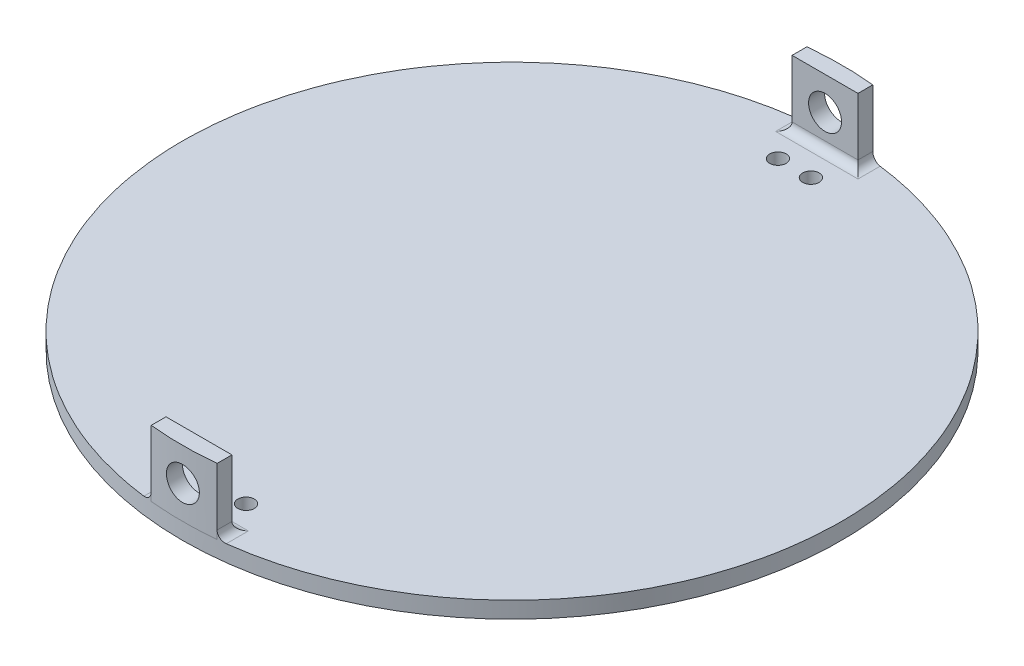
from build123d import *

# Parameters (mm, degrees)
SKETCH1_R               = 50.8
BOSS_EXTRUDE1_DEPTH     = 2.54
BOSS_EXTRUDE2_DEPTH     = 10.16
FILLET1_R               = 1.27
CUT_EXTRUDE1_DEPTH      = 113.048264746
CUT_EXTRUDE1_DEPTH_BACK = 113.048264746
SKETCH3_R               = 2.54
SKETCH5_R               = 1.27
CUT_EXTRUDE2_DEPTH      = 73.556912988


# Read off the part's stored shape, not the designer's step: Boss-Extrude2
with BuildPart() as part:
    # Sketch1 → Boss-Extrude1 (new body)
    with BuildSketch(Plane(origin=(0, 0, 0), x_dir=(1, 0, 0), z_dir=(0, 1, 0))):
        with Locations(Location((0, 0, 0), (0, 0, 270))):
            Circle(SKETCH1_R)
    extrude(amount=BOSS_EXTRUDE1_DEPTH)


with BuildPart() as boss_extrude2_tool:
    # Boss-Extrude2 outline → Boss-Extrude2 (new body)
    with BuildSketch(Plane(origin=(0, 2.54, 0), x_dir=(1, 0, 0), z_dir=(0, 1, 0))):
        with BuildLine():
            Line((-5.08, -48.26), (-5.08, -50.545361805))
            add(Edge.make_bspline(
                [(5.08, -50.545361805), (0, -51.054638195), (-5.08, -50.545361805)],
                knots=[0, 0, 0, 1, 1, 1], degree=2))
            Line((5.08, -50.545361805), (5.08, -48.26))
            Line((5.08, -48.26), (-5.08, -48.26))
        make_face()
        with BuildLine():
            Line((5.08, 48.26), (5.08, 50.545361805))
            add(Edge.make_bspline(
                [(-5.08, 50.545361805), (0, 51.054638195), (5.08, 50.545361805)],
                knots=[0, 0, 0, 1, 1, 1], degree=2))
            Line((-5.08, 50.545361805), (-5.08, 48.26))
            Line((-5.08, 48.26), (5.08, 48.26))
        make_face()
    extrude(amount=BOSS_EXTRUDE2_DEPTH)


with BuildPart() as part_1:
    add(part.part)


with BuildPart() as part_2:
    # Boss-Extrude2: joined with boss_extrude2_tool
    add(part_1.part.fuse(boss_extrude2_tool.part, tol=0.00001))

    # Fillet1
    # the kernel refuses this fillet: 1.27 mm, written as the material it adds along each edge
    with BuildSketch(Plane(origin=(-5.08, 2.54, -48.26), x_dir=(0, 0, 1), z_dir=(1, 0, 0)), Plane(origin=(5.08, 2.54, 48.26), x_dir=(0, 0, -1), z_dir=(-1, 0, 0))) as fillet1_piece_1:
        with BuildLine():
            CenterArc((FILLET1_R, -FILLET1_R), FILLET1_R, 90, 90)
            Line((0, -FILLET1_R), (0, 0))
            Line((0, 0), (FILLET1_R, 0))
        make_face()
    extrude(amount=10.16)
    with BuildSketch(Plane(origin=(5.08, 2.54, -48.26), x_dir=(1, 0, 0), z_dir=(0, 0, -1))) as fillet1_piece_2_section:
        with BuildLine():
            CenterArc((FILLET1_R, -FILLET1_R), FILLET1_R, 90, 90)
            Line((0, -FILLET1_R), (0, 0))
            Line((0, 0), (FILLET1_R, 0))
        make_face()
    fillet1_piece_2 = extrude(amount=5.460361805, mode=Mode.PRIVATE)
    fillet1_piece_2 = fillet1_piece_2 & Plane(origin=(0, 2.829642474, 0), x_dir=(0, 0, 1), z_dir=(0, -1, 0)) * Cylinder(50.8, 17, mode=Mode.PRIVATE)
    add(fillet1_piece_2)
    with BuildSketch(Plane(origin=(5.08, 2.54, 53.720361805), x_dir=(1, 0, 0), z_dir=(0, 0, -1))) as fillet1_piece_3_section:
        with BuildLine():
            CenterArc((FILLET1_R, -FILLET1_R), FILLET1_R, 90, 90)
            Line((0, -FILLET1_R), (0, 0))
            Line((0, 0), (FILLET1_R, 0))
        make_face()
    fillet1_piece_3 = extrude(amount=5.460361805, mode=Mode.PRIVATE)
    fillet1_piece_3 = fillet1_piece_3 & Plane(origin=(0, 2.829642639, 0), x_dir=(0, 0, 1), z_dir=(0, -1, 0)) * Cylinder(50.8, 17, mode=Mode.PRIVATE)
    add(fillet1_piece_3)
    with BuildSketch(Plane(origin=(-5.08, 2.54, 48.26), x_dir=(-1, 0, 0), z_dir=(0, 0, 1))) as fillet1_piece_4_section:
        with BuildLine():
            CenterArc((FILLET1_R, -FILLET1_R), FILLET1_R, 90, 90)
            Line((0, -FILLET1_R), (0, 0))
            Line((0, 0), (FILLET1_R, 0))
        make_face()
    fillet1_piece_4 = extrude(amount=5.460361805, mode=Mode.PRIVATE)
    fillet1_piece_4 = fillet1_piece_4 & Plane(origin=(0, 2.829642474, 0), x_dir=(0, 0, 1), z_dir=(0, -1, 0)) * Cylinder(50.8, 17, mode=Mode.PRIVATE)
    add(fillet1_piece_4)
    with BuildSketch(Plane(origin=(-5.08, 2.54, -53.720361805), x_dir=(-1, 0, 0), z_dir=(0, 0, 1))) as fillet1_piece_5_section:
        with BuildLine():
            CenterArc((FILLET1_R, -FILLET1_R), FILLET1_R, 90, 90)
            Line((0, -FILLET1_R), (0, 0))
            Line((0, 0), (FILLET1_R, 0))
        make_face()
    fillet1_piece_5 = extrude(amount=5.460361805, mode=Mode.PRIVATE)
    fillet1_piece_5 = fillet1_piece_5 & Plane(origin=(0, 2.829642639, 0), x_dir=(0, 0, 1), z_dir=(0, -1, 0)) * Cylinder(50.8, 17, mode=Mode.PRIVATE)
    add(fillet1_piece_5)
    with BuildSketch(Plane(origin=(-5.08, 2.54, -53.720361805), x_dir=(-1, 0, 0), z_dir=(0, 0, 1))) as fillet1_piece_6a_section:
        with BuildLine():
            CenterArc((FILLET1_R, -FILLET1_R), FILLET1_R, 90, 90)
            Line((0, -FILLET1_R), (0, 0))
            Line((0, 0), (FILLET1_R, 0))
        make_face()
    fillet1_piece_6a = extrude(amount=8.635361805, mode=Mode.PRIVATE)
    fillet1_piece_6a = split(fillet1_piece_6a, bisect_by=Plane(origin=(-5.367521795, 2.827521795, -48.26), z_dir=(0, 0, 1)), keep=Keep.TOP, mode=Mode.PRIVATE)
    with BuildSketch(Plane(origin=(-8.255, 2.54, -48.26), x_dir=(0, 0, 1), z_dir=(1, 0, 0))) as fillet1_piece_6b_section:
        with BuildLine():
            CenterArc((FILLET1_R, -FILLET1_R), FILLET1_R, 90, 90)
            Line((0, -FILLET1_R), (0, 0))
            Line((0, 0), (FILLET1_R, 0))
        make_face()
    fillet1_piece_6b = extrude(amount=13.335, mode=Mode.PRIVATE)
    fillet1_piece_6b = split(fillet1_piece_6b, bisect_by=Plane(origin=(-5.08, 2.827521795, -47.972478205), z_dir=(-1, 0, 0)), keep=Keep.TOP, mode=Mode.PRIVATE)
    fillet1_piece_6 = fillet1_piece_6a & fillet1_piece_6b
    add(fillet1_piece_6)
    with BuildSketch(Plane(origin=(-5.08, 2.54, -48.26), x_dir=(0, 0, 1), z_dir=(1, 0, 0))) as fillet1_piece_7a_section:
        with BuildLine():
            CenterArc((FILLET1_R, -FILLET1_R), FILLET1_R, 90, 90)
            Line((0, -FILLET1_R), (0, 0))
            Line((0, 0), (FILLET1_R, 0))
        make_face()
    fillet1_piece_7a = extrude(amount=13.335, mode=Mode.PRIVATE)
    fillet1_piece_7a = split(fillet1_piece_7a, bisect_by=Plane(origin=(5.08, 2.827521795, -47.972478205), z_dir=(1, 0, 0)), keep=Keep.TOP, mode=Mode.PRIVATE)
    with BuildSketch(Plane(origin=(5.08, 2.54, -45.085), x_dir=(1, 0, 0), z_dir=(0, 0, -1))) as fillet1_piece_7b_section:
        with BuildLine():
            CenterArc((FILLET1_R, -FILLET1_R), FILLET1_R, 90, 90)
            Line((0, -FILLET1_R), (0, 0))
            Line((0, 0), (FILLET1_R, 0))
        make_face()
    fillet1_piece_7b = extrude(amount=8.635361805, mode=Mode.PRIVATE)
    fillet1_piece_7b = split(fillet1_piece_7b, bisect_by=Plane(origin=(5.367521795, 2.827521795, -48.26), z_dir=(0, 0, 1)), keep=Keep.TOP, mode=Mode.PRIVATE)
    fillet1_piece_7 = fillet1_piece_7a & fillet1_piece_7b
    add(fillet1_piece_7)
    with BuildSketch(Plane(origin=(5.08, 2.54, 53.720361805), x_dir=(1, 0, 0), z_dir=(0, 0, -1))) as fillet1_piece_8a_section:
        with BuildLine():
            CenterArc((FILLET1_R, -FILLET1_R), FILLET1_R, 90, 90)
            Line((0, -FILLET1_R), (0, 0))
            Line((0, 0), (FILLET1_R, 0))
        make_face()
    fillet1_piece_8a = extrude(amount=8.635361805, mode=Mode.PRIVATE)
    fillet1_piece_8a = split(fillet1_piece_8a, bisect_by=Plane(origin=(5.367521795, 2.827521795, 48.26), z_dir=(0, 0, -1)), keep=Keep.TOP, mode=Mode.PRIVATE)
    with BuildSketch(Plane(origin=(8.255, 2.54, 48.26), x_dir=(0, 0, -1), z_dir=(-1, 0, 0))) as fillet1_piece_8b_section:
        with BuildLine():
            CenterArc((FILLET1_R, -FILLET1_R), FILLET1_R, 90, 90)
            Line((0, -FILLET1_R), (0, 0))
            Line((0, 0), (FILLET1_R, 0))
        make_face()
    fillet1_piece_8b = extrude(amount=13.335, mode=Mode.PRIVATE)
    fillet1_piece_8b = split(fillet1_piece_8b, bisect_by=Plane(origin=(5.08, 2.827521795, 47.972478205), z_dir=(1, 0, 0)), keep=Keep.TOP, mode=Mode.PRIVATE)
    fillet1_piece_8 = fillet1_piece_8a & fillet1_piece_8b
    add(fillet1_piece_8)
    with BuildSketch(Plane(origin=(5.08, 2.54, 48.26), x_dir=(0, 0, -1), z_dir=(-1, 0, 0))) as fillet1_piece_9a_section:
        with BuildLine():
            CenterArc((FILLET1_R, -FILLET1_R), FILLET1_R, 90, 90)
            Line((0, -FILLET1_R), (0, 0))
            Line((0, 0), (FILLET1_R, 0))
        make_face()
    fillet1_piece_9a = extrude(amount=13.335, mode=Mode.PRIVATE)
    fillet1_piece_9a = split(fillet1_piece_9a, bisect_by=Plane(origin=(-5.08, 2.827521795, 47.972478205), z_dir=(-1, 0, 0)), keep=Keep.TOP, mode=Mode.PRIVATE)
    with BuildSketch(Plane(origin=(-5.08, 2.54, 45.085), x_dir=(-1, 0, 0), z_dir=(0, 0, 1))) as fillet1_piece_9b_section:
        with BuildLine():
            CenterArc((FILLET1_R, -FILLET1_R), FILLET1_R, 90, 90)
            Line((0, -FILLET1_R), (0, 0))
            Line((0, 0), (FILLET1_R, 0))
        make_face()
    fillet1_piece_9b = extrude(amount=8.635361805, mode=Mode.PRIVATE)
    fillet1_piece_9b = split(fillet1_piece_9b, bisect_by=Plane(origin=(-5.367521795, 2.827521795, 48.26), z_dir=(0, 0, -1)), keep=Keep.TOP, mode=Mode.PRIVATE)
    fillet1_piece_9 = fillet1_piece_9a & fillet1_piece_9b
    add(fillet1_piece_9)

    # Sketch3 → Cut-Extrude1 (cut, two sides: drawn at the far end of the back side and taken through both)
    with BuildSketch(Plane(origin=(0, 0, 48.26), x_dir=(-1, 0, 0), z_dir=(0, 0, -1)).offset(-CUT_EXTRUDE1_DEPTH_BACK)):
        with Locations((0, 7.62)):
            Circle(SKETCH3_R)
    extrude(amount=CUT_EXTRUDE1_DEPTH + CUT_EXTRUDE1_DEPTH_BACK, mode=Mode.SUBTRACT)

    # Sketch5 → Cut-Extrude2 (cut, through all)
    with BuildSketch(Plane(origin=(0, 2.54, 0), x_dir=(1, 0, 0), z_dir=(0, 1, 0))):
        with Locations(Location((-2.54, 43.536503653, 0), (0, 0, 270))):
            Circle(SKETCH5_R)
        with Locations(Location((2.54, 43.536503653, 0), (0, 0, 270))):
            Circle(SKETCH5_R)
        with Locations(Location((2.54, -43.536503653, 0), (0, 0, 90))):
            Circle(SKETCH5_R)
        with Locations(Location((-2.54, -43.536503653, 0), (0, 0, 90))):
            Circle(SKETCH5_R)
    extrude(amount=-CUT_EXTRUDE2_DEPTH, mode=Mode.SUBTRACT)


solid = part_2.part
